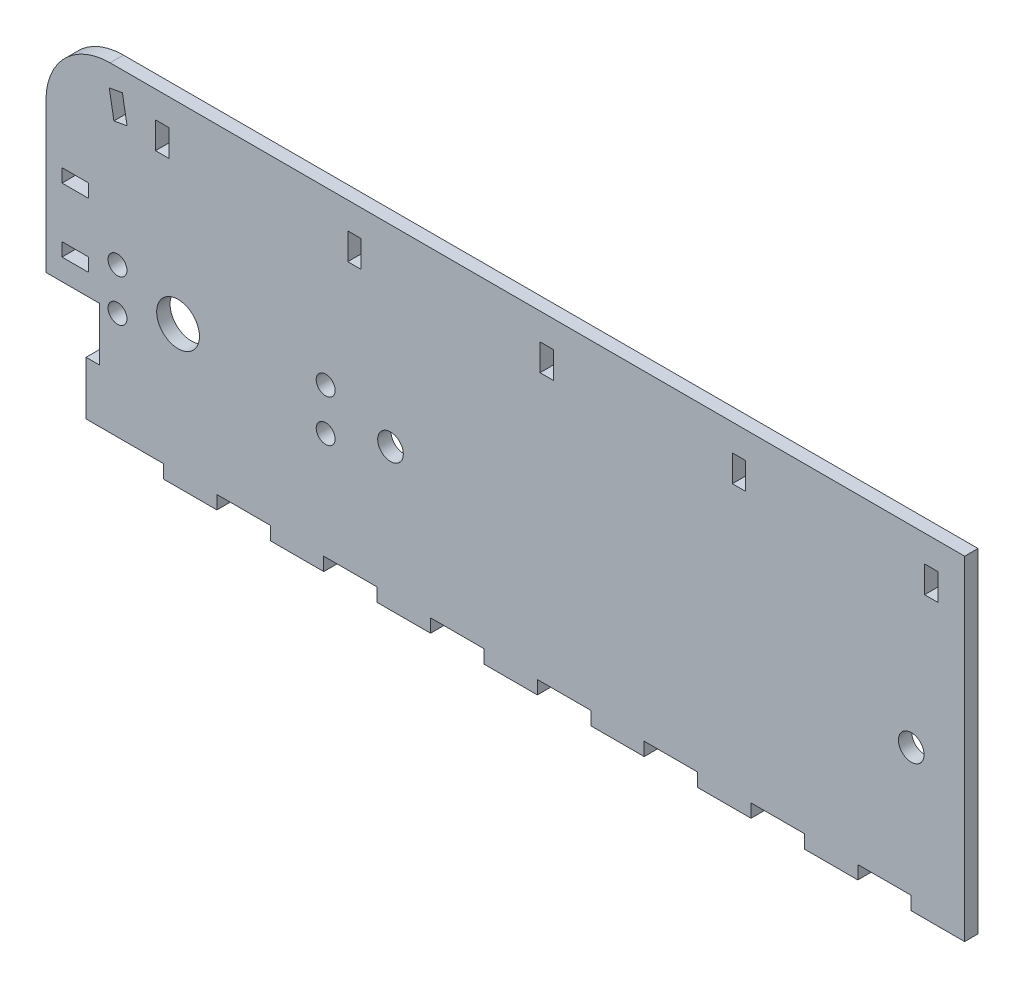
from build123d import *

# Parameters (mm, degrees)
SKETCH1_W           = 228.6
SKETCH1_H           = 76.2
SKETCH1_R           = 3.048
SKETCH1_R_2         = 5.08
BOSS_EXTRUDE1_DEPTH = 3.175
SKETCH2_W           = 12.7
SKETCH2_H           = 3.175
BOSS_EXTRUDE2_DEPTH = 3.175
SKETCH3_W           = 22.86
SKETCH3_H           = 25.4
CUT_EXTRUDE1_DEPTH  = 241.986473946
SKETCH4_W           = 3.175
SKETCH4_H           = 12.7
BOSS_EXTRUDE3_DEPTH = 3.175
SKETCH6_R           = 2.25
CUT_EXTRUDE2_DEPTH  = 241.986473946
SKETCH8_W           = 10.16
SKETCH8_H           = 50.8
CUT_EXTRUDE3_DEPTH  = 241.986473946
SKETCH12_W          = 3.175
SKETCH12_H          = 6.35
CUT_EXTRUDE5_DEPTH  = 3.175
CUT_EXTRUDE6_DEPTH  = 241.986473946
SKETCH14_W          = 6.35
SKETCH14_H          = 3.175
CUT_EXTRUDE7_DEPTH  = 241.986473946
CUT_EXTRUDE8_DEPTH  = 241.986473946


with BuildPart() as part:
    # Sketch1 → Boss-Extrude1 (new body)
    with BuildSketch(Plane.XY):
        with Locations((114.3, 38.1)):
            Rectangle(SKETCH1_W, SKETCH1_H)
        with Locations((215.9, 30.48)):
            Circle(SKETCH1_R, mode=Mode.SUBTRACT)
        with Locations((92.075, 30.48)):
            Circle(SKETCH1_R, mode=Mode.SUBTRACT)
        with Locations((41.56075, 30.48)):
            Circle(SKETCH1_R_2, mode=Mode.SUBTRACT)
    extrude(amount=BOSS_EXTRUDE1_DEPTH)

    # Sketch2 → Boss-Extrude2 (add)
    with BuildSketch(Plane.XZ):
        with Locations((222.25, 1.5875)):
            Rectangle(SKETCH2_W, SKETCH2_H)
        with Locations((196.85, 1.5875)):
            Rectangle(SKETCH2_W, SKETCH2_H)
        with Locations((171.45, 1.5875)):
            Rectangle(SKETCH2_W, SKETCH2_H)
        with Locations((146.05, 1.5875)):
            Rectangle(SKETCH2_W, SKETCH2_H)
        with Locations((120.65, 1.5875)):
            Rectangle(SKETCH2_W, SKETCH2_H)
        with Locations((95.25, 1.5875)):
            Rectangle(SKETCH2_W, SKETCH2_H)
        with Locations((69.85, 1.5875)):
            Rectangle(SKETCH2_W, SKETCH2_H)
        with Locations((44.45, 1.5875)):
            Rectangle(SKETCH2_W, SKETCH2_H)
    extrude(amount=BOSS_EXTRUDE2_DEPTH)

    # Sketch3 → Cut-Extrude1 (cut, through all)
    with BuildSketch(Plane(origin=(0, 0, 0), x_dir=(-1, 0, 0), z_dir=(0, 0, -1))):
        with Locations((-11.43, 12.7)):
            Rectangle(SKETCH3_W, SKETCH3_H)
    extrude(amount=-CUT_EXTRUDE1_DEPTH, mode=Mode.SUBTRACT)

    # Sketch4 → Boss-Extrude3 (add)
    with BuildSketch(Plane.ZY.offset(-22.86)):
        with Locations((1.5875, 6.35)):
            Rectangle(SKETCH4_W, SKETCH4_H)
    extrude(amount=BOSS_EXTRUDE3_DEPTH)

    # Sketch6 → Cut-Extrude2 (cut, through all)
    with BuildSketch(Plane(origin=(0, 0, 0), x_dir=(-1, 0, 0), z_dir=(0, 0, -1))):
        with Locations((-27.16075, 35.48)):
            Circle(SKETCH6_R)
        with Locations((-27.16075, 25.48)):
            Circle(SKETCH6_R)
        with Locations((-76.66075, 35.48)):
            Circle(SKETCH6_R)
        with Locations((-76.66075, 25.48)):
            Circle(SKETCH6_R)
    extrude(amount=-CUT_EXTRUDE2_DEPTH, mode=Mode.SUBTRACT)

    # Sketch8 → Cut-Extrude3 (cut, through all)
    with BuildSketch(Plane.XY.offset(3.175)):
        with Locations((5.08, 50.8)):
            Rectangle(SKETCH8_W, SKETCH8_H)
    extrude(amount=-CUT_EXTRUDE3_DEPTH, mode=Mode.SUBTRACT)

    # Sketch12 → Cut-Extrude5 (cut)
    with BuildSketch(Plane(origin=(0, 0, 0), x_dir=(-1, 0, 0), z_dir=(0, 0, -1))):
        with Locations((-220.6625, 66.675)):
            Rectangle(SKETCH12_W, SKETCH12_H)
        with Locations((-174.9425, 66.675)):
            Rectangle(SKETCH12_W, SKETCH12_H)
        with Locations((-129.2225, 66.675)):
            Rectangle(SKETCH12_W, SKETCH12_H)
        with Locations((-83.5025, 66.675)):
            Rectangle(SKETCH12_W, SKETCH12_H)
        with Locations((-37.7825, 66.675)):
            Rectangle(SKETCH12_W, SKETCH12_H)
    extrude(amount=-CUT_EXTRUDE5_DEPTH, mode=Mode.SUBTRACT)

    # Sketch13 → Cut-Extrude6 (cut, through all)
    with BuildSketch(Plane.XY.offset(3.175)):
        with BuildLine():
            Line((10.16, 60.96), (10.16, 76.2))
            Line((10.16, 76.2), (25.4, 76.2))
            ThreePointArc((25.4, 76.2), (14.623692655, 71.736307345), (10.16, 60.96))
        make_face()
    extrude(amount=-CUT_EXTRUDE6_DEPTH, mode=Mode.SUBTRACT)

    # Sketch14 → Cut-Extrude7 (cut, through all)
    with BuildSketch(Plane.XY.offset(3.175)):
        with Locations((17.145, 32.0675)):
            Rectangle(SKETCH14_W, SKETCH14_H)
        with Locations((17.145, 47.3075)):
            Rectangle(SKETCH14_W, SKETCH14_H)
    extrude(amount=-CUT_EXTRUDE7_DEPTH, mode=Mode.SUBTRACT)

    # Sketch15 → Cut-Extrude8 (cut, through all)
    with BuildSketch(Plane.XY.offset(3.175)):
        Polygon((26.305911498, 64.686592226), (25.20324557, 70.940121458), (28.330010186, 71.491454422), (29.432676114, 65.23792519), align=None)
    extrude(amount=-CUT_EXTRUDE8_DEPTH, mode=Mode.SUBTRACT)


solid = part.part
